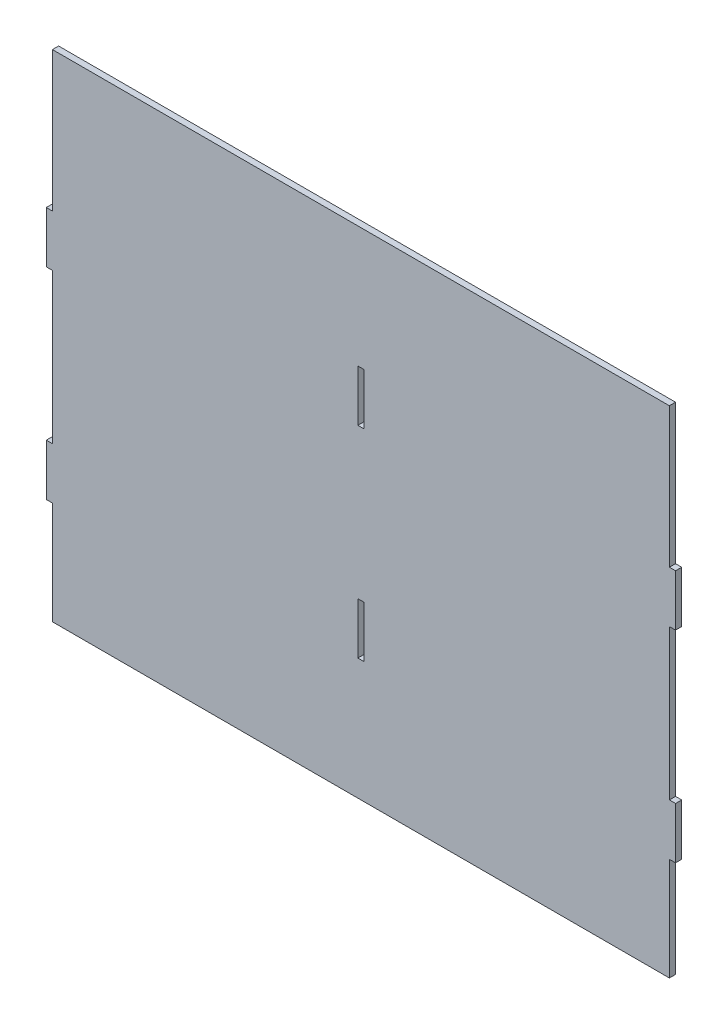
from build123d import *

# Parameters (mm, degrees)
SKETCH1_W           = 6
SKETCH1_H           = 50
BOSS_EXTRUDE1_DEPTH = 6


with BuildPart() as part:
    # Sketch1 → Boss-Extrude1 (new body)
    with BuildSketch(Plane.XY):
        Polygon((-300, 241), (300, 241), (300, 105), (306, 105), (306, 55), (300, 55), (300, -91), (306, -91), (306, -141), (300, -141), (300, -241), (-300, -241), (-300, -141), (-306, -141), (-306, -91), (-300, -91), (-300, 55), (-306, 55), (-306, 105), (-300, 105), align=None)
        with Locations((0, 98)):
            Rectangle(SKETCH1_W, SKETCH1_H, mode=Mode.SUBTRACT)
        with Locations((0, -98)):
            Rectangle(SKETCH1_W, SKETCH1_H, mode=Mode.SUBTRACT)
    extrude(amount=BOSS_EXTRUDE1_DEPTH)


solid = part.part
